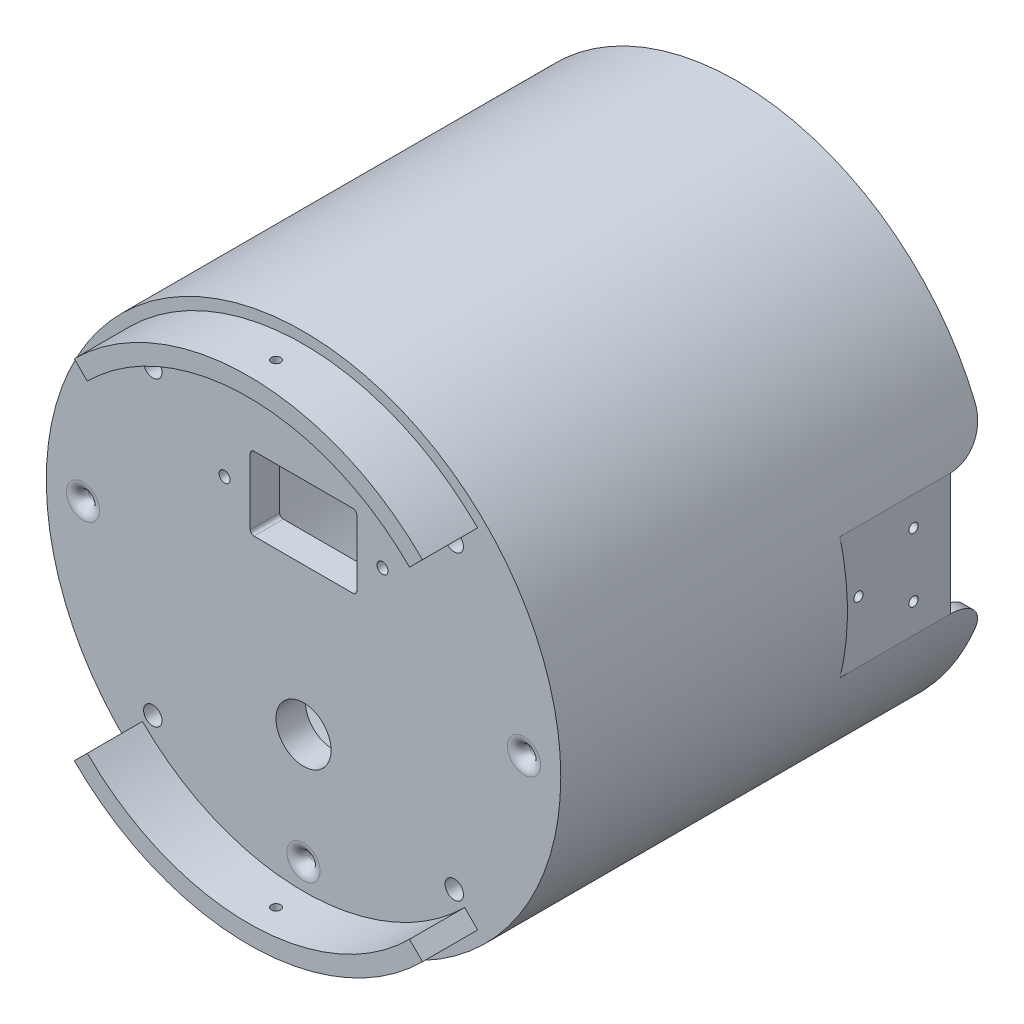
from build123d import *
from build123d.topology import SkipClean

# Parameters (mm, degrees)
SKETCH1_R               = 70
SKETCH1_R_2             = 67
BOSS_EXTRUDE1_DEPTH     = 8
SKETCH2_R               = 1.5
CUT_EXTRUDE2_DEPTH      = 20
BOSS_EXTRUDE2_START     = -100
SKETCH1_3_R             = 70
SKETCH1_3_R_2           = 67
BOSS_EXTRUDE2_DEPTH     = 100
BOSS_EXTRUDE3_DEPTH     = 15
CUT_EXTRUDE3_DEPTH      = 117
CUT_EXTRUDE3_DEPTH_BACK = 117
SKETCH5_R               = 1.25
FILLET4_R               = 3
SKETCH7_R               = 2.5
CUT_EXTRUDE6_DEPTH      = 14
CUT_EXTRUDE7_DEPTH      = 2
SKETCH9_R               = 1.5
SKETCH9_R_2             = 7.5
SKETCH9_W               = 29
SKETCH9_H               = 20
CUT_EXTRUDE8_DEPTH      = 28
BOSS_EXTRUDE4_DEPTH     = 30
CUT_EXTRUDE9_DEPTH      = 40
FILLET5_R               = 1
CUT_EXTRUDE10_DEPTH     = 30
BOSS_EXTRUDE5_START     = 10
BOSS_EXTRUDE5_DEPTH     = 10
FILLET6_START           = -69
FILLET6_DEPTH           = 138


with BuildPart() as part:
    # Sketch1 → Boss-Extrude1 (new body)
    # profile 1 of 2: a face of its own
    with BuildSketch(Plane.XY):
        Circle(SKETCH1_R)
        Circle(SKETCH1_R_2, mode=Mode.SUBTRACT)
    # profile 2 of 2: a face of its own
    with BuildSketch(Plane.XY):
        Circle(SKETCH1_R_2)
    extrude(amount=BOSS_EXTRUDE1_DEPTH)

    # Sketch2 → Cut-Extrude2 (cut)
    with BuildSketch(Plane.XY.offset(8)):
        with Locations((-60, 0)):
            Circle(SKETCH2_R)
        with Locations((60, 0)):
            Circle(SKETCH2_R)
        with Locations((0, 55)):
            Circle(SKETCH2_R)
        with Locations((0, -55)):
            Circle(SKETCH2_R)
    extrude(amount=-CUT_EXTRUDE2_DEPTH, mode=Mode.SUBTRACT)

    # Sketch1<3> → Boss-Extrude2 (add)
    with BuildSketch(Plane.XY.offset(BOSS_EXTRUDE2_START)):
        Circle(SKETCH1_3_R)
        Circle(SKETCH1_3_R_2, mode=Mode.SUBTRACT)
    extrude(amount=BOSS_EXTRUDE2_DEPTH)

    # Sketch3 → Boss-Extrude3 (add)
    with BuildSketch(Plane.XY.offset(8)):
        with BuildLine():
            ThreePointArc((-43.840620434, -43.840620434), (0, -62), (43.840620434, -43.840620434))
            Line((43.840620434, -43.840620434), (47.376154339, -47.376154339))
            ThreePointArc((47.376154339, -47.376154339), (0, -67), (-47.376154339, -47.376154339))
            Line((-47.376154339, -47.376154339), (-43.840620434, -43.840620434))
        make_face()
        with BuildLine():
            ThreePointArc((43.840620434, 43.840620434), (0, 62), (-43.840620434, 43.840620434))
            Line((-43.840620434, 43.840620434), (-47.376154339, 47.376154339))
            ThreePointArc((-47.376154339, 47.376154339), (0, 67), (47.376154339, 47.376154339))
            Line((47.376154339, 47.376154339), (43.840620434, 43.840620434))
        make_face()
    extrude(amount=BOSS_EXTRUDE3_DEPTH)

    # Sketch5 → Cut-Extrude3 (cut, two sides: drawn at the far end of the back side and taken through both)
    with BuildSketch(Plane(origin=(0, 0, 0), x_dir=(1, 0, 0), z_dir=(0, 1, 0)).offset(-CUT_EXTRUDE3_DEPTH_BACK)):
        with Locations(Location((0, -15.5, 0), (0, 0, 90))):
            Circle(SKETCH5_R)
    extrude(amount=CUT_EXTRUDE3_DEPTH + CUT_EXTRUDE3_DEPTH_BACK, mode=Mode.SUBTRACT)

    # Fillet4
    fillet4_edges = [part.edges().sort_by_distance(p)[0] for p in [
        (-61.5, 0, 8),
        (-1.5, 55, 8),
        (58.5, 0, 8),
        (-1.5, -55, 8),
    ]]
    fillet(fillet4_edges, radius=FILLET4_R)

    # Sketch7 → Cut-Extrude6 (cut)
    with BuildSketch(Plane.XY.offset(8)):
        with Locations((41.012193309, 41.012193309)):
            Circle(SKETCH7_R)
        with Locations((41.012193309, -41.012193309)):
            Circle(SKETCH7_R)
        with Locations((-41.012193309, -41.012193309)):
            Circle(SKETCH7_R)
        with Locations((-41.012193309, 41.012193309)):
            Circle(SKETCH7_R)
    extrude(amount=-CUT_EXTRUDE6_DEPTH, mode=Mode.SUBTRACT)

    # Sketch8 → Cut-Extrude7 (cut)
    with BuildSketch(Plane(origin=(0, 0, 0), x_dir=(-1, 0, 0), z_dir=(0, 0, -1))):
        Polygon((39.841147095, 36.663785466), (44.192501859, 37.823833617), (45.363548073, 42.17224146), (42.183239523, 45.360601151), (37.831884758, 44.200553), (36.660838544, 39.852145158), align=None)
        Polygon((-36.663785466, 39.841147095), (-37.823833617, 44.192501859), (-42.17224146, 45.363548073), (-45.360601151, 42.183239523), (-44.200553, 37.831884758), (-39.852145158, 36.660838544), align=None)
        Polygon((36.663785466, -39.841147095), (37.823833617, -44.192501859), (42.17224146, -45.363548073), (45.360601151, -42.183239523), (44.200553, -37.831884758), (39.852145158, -36.660838544), align=None)
        Polygon((-39.841147095, -36.663785466), (-44.192501859, -37.823833617), (-45.363548073, -42.17224146), (-42.183239523, -45.360601151), (-37.831884758, -44.200553), (-36.660838544, -39.852145158), align=None)
    extrude(amount=-CUT_EXTRUDE7_DEPTH, mode=Mode.SUBTRACT)

    # Sketch9 → Cut-Extrude8 (cut)
    with BuildSketch(Plane.XY.offset(8)):
        with Locations((-21.5, 25)):
            Circle(SKETCH9_R)
        with Locations((21.5, 25)):
            Circle(SKETCH9_R)
        with Locations((0, -25)):
            Circle(SKETCH9_R_2)
        with Locations((0, 25)):
            Rectangle(SKETCH9_W, SKETCH9_H)
    extrude(amount=-CUT_EXTRUDE8_DEPTH, mode=Mode.SUBTRACT)

    # Sketch11 → Boss-Extrude4 (add)
    with SkipClean():  # the faces are left unmerged after this step: merging them gives an invalid solid
        with BuildSketch(Plane(origin=(0, 0, -100), x_dir=(-1, 0, 0), z_dir=(0, 0, -1))):
            with BuildLine():
                ThreePointArc((67, 0), (66.623944645, 7.088723439), (65.5, 14.09787218))
                Line((65.5, 14.09787218), (65.5, 0))
                Line((65.5, 0), (67, 0))
            make_face()
            with BuildLine():
                Line((67, 0), (65.5, 0))
                Line((65.5, 0), (65.5, -14.09787218))
                ThreePointArc((65.5, -14.09787218), (66.623944645, -7.088723439), (67, 0))
            make_face()
            with BuildLine():
                ThreePointArc((70, 0), (68.865811547, 12.549900398), (65.5, 24.69311645))
                Line((65.5, 24.69311645), (65.5, 14.09787218))
                ThreePointArc((65.5, 14.09787218), (66.623944645, 7.088723439), (67, 0))
                Line((67, 0), (70, 0))
            make_face()
            with BuildLine():
                ThreePointArc((65.5, -24.69311645), (68.865811547, -12.549900398), (70, 0))
                Line((70, 0), (67, 0))
                ThreePointArc((67, 0), (66.623944645, -7.088723439), (65.5, -14.09787218))
                Line((65.5, -14.09787218), (65.5, -24.69311645))
            make_face()
        boss_extrude4 = extrude(amount=-BOSS_EXTRUDE4_DEPTH)

    # Sketch13 → Cut-Extrude9 (cut)
    with SkipClean():  # the faces are left unmerged after this step: merging them gives an invalid solid
        with BuildSketch(Plane(origin=(-65.5, 0, 0), x_dir=(0, 0, -1), z_dir=(1, 0, 0))):
            with BuildLine():
                ThreePointArc((91.041352866, 7.968817701), (91.196701943, 8.299138463), (91.25, 8.660254038))
                ThreePointArc((91.25, 8.660254038), (90.28561571, 9.877186109), (88.880522134, 9.216373906))
                ThreePointArc((88.880522134, 9.216373906), (90, 8.660254038), (91.041352866, 7.968817701))
            make_face()
            with BuildLine():
                ThreePointArc((91.041352866, 7.968817701), (90, 8.660254038), (88.880522134, 9.216373906))
                ThreePointArc((88.880522134, 9.216373906), (89.375, 7.577722283), (91.041352866, 7.968817701))
            make_face()
            with BuildLine():
                ThreePointArc((76.25, 0), (75.911086234, 0.855816496), (75.078125, 1.247556205))
                ThreePointArc((75.078125, 1.247556205), (75, 0), (75.078125, -1.247556205))
                ThreePointArc((75.078125, -1.247556205), (75.911086234, -0.855816496), (76.25, 0))
            make_face()
            with BuildLine():
                ThreePointArc((75.078125, -1.247556205), (75, 0), (75.078125, 1.247556205))
                ThreePointArc((75.078125, 1.247556205), (73.75, 0), (75.078125, -1.247556205))
            make_face()
            with BuildLine():
                ThreePointArc((88.880522134, -9.216373906), (90.28561571, -9.877186109), (91.25, -8.660254038))
                ThreePointArc((91.25, -8.660254038), (91.196701943, -8.299138463), (91.041352866, -7.968817701))
                ThreePointArc((91.041352866, -7.968817701), (90, -8.660254038), (88.880522134, -9.216373906))
            make_face()
            with BuildLine():
                ThreePointArc((88.880522134, -9.216373906), (90, -8.660254038), (91.041352866, -7.968817701))
                ThreePointArc((91.041352866, -7.968817701), (89.375, -7.577722283), (88.880522134, -9.216373906))
            make_face()
        cut_extrude9 = extrude(amount=-CUT_EXTRUDE9_DEPTH, mode=Mode.SUBTRACT)

    # Mirror2: Boss-Extrude4, Cut-Extrude9 across plane
    with SkipClean():  # the faces are left unmerged after this step: merging them gives an invalid solid
        add(boss_extrude4.mirror(Plane(origin=(0, 0, 0), x_dir=(0, 0, 1), z_dir=(1, 0, 0))))
        add(cut_extrude9.mirror(Plane(origin=(0, 0, 0), x_dir=(0, 0, 1), z_dir=(1, 0, 0))), mode=Mode.SUBTRACT)

    # Fillet5
    fillet5_edges = [part.edges().sort_by_distance(p)[0] for p in [
        (-14.5, 35, 4),
        (14.5, 35, 4),
        (14.5, 15, 4),
        (-14.5, 15, 4),
    ]]
    fillet(fillet5_edges, radius=FILLET5_R)

    # Sketch14 → Cut-Extrude10 (cut)
    with SkipClean():  # the faces are left unmerged after this step: merging them gives an invalid solid
        with BuildSketch(Plane(origin=(0, 0, -100), x_dir=(-1, 0, 0), z_dir=(0, 0, -1))):
            with BuildLine():
                ThreePointArc((70, 0), (69.498201416, 8.366600265), (68, 16.613247726))
                Line((68, 16.613247726), (68, 0))
                Line((68, 0), (70, 0))
            make_face()
            with BuildLine():
                Line((70, 0), (68, 0))
                Line((68, 0), (68, -16.613247726))
                ThreePointArc((68, -16.613247726), (69.498201416, -8.366600265), (70, 0))
            make_face()
        cut_extrude10 = extrude(amount=-CUT_EXTRUDE10_DEPTH, mode=Mode.SUBTRACT)

    # Mirror4: Cut-Extrude10 across plane
    with SkipClean():  # the faces are left unmerged after this step: merging them gives an invalid solid
        add(cut_extrude10.mirror(Plane(origin=(0, 0, 0), x_dir=(0, 0, 1), z_dir=(1, 0, 0))), mode=Mode.SUBTRACT)

    # Sketch15 → Boss-Extrude5 (add)
    with SkipClean():  # the faces are left unmerged after this step: merging them gives an invalid solid
        with BuildSketch(Plane(origin=(0, 0, -100), x_dir=(-1, 0, 0), z_dir=(0, 0, -1)).offset(BOSS_EXTRUDE5_START)):
            with BuildLine():
                Line((-68, -16.613247726), (-64.907626671, -16.613247726))
                ThreePointArc((-64.907626671, -16.613247726), (0, -67), (64.907626671, -16.613247726))
                Line((64.907626671, -16.613247726), (68, -16.613247726))
                ThreePointArc((68, -16.613247726), (0, -70), (-68, -16.613247726))
            make_face()
            with BuildLine():
                Line((-68, 16.613247726), (-64.907626671, 16.613247726))
                ThreePointArc((-64.907626671, 16.613247726), (0, 67), (64.907626671, 16.613247726))
                Line((64.907626671, 16.613247726), (68, 16.613247726))
                ThreePointArc((68, 16.613247726), (0, 70), (-68, 16.613247726))
            make_face()
        extrude(amount=-BOSS_EXTRUDE5_DEPTH)

    # Fillet6: read off the stored shape, not the designer's step
    # Fillet6 outline → Fillet6 (cut)
    with SkipClean():  # the faces are left unmerged after this step: merging them gives an invalid solid
        with BuildSketch(Plane.YZ.offset(FILLET6_START)):
            with BuildLine():
                Line((-16.613247726, -110), (-16.613247726, -100))
                ThreePointArc((-16.613247726, -100), (-19.542179914, -107.071067812), (-26.613247726, -110))
                Line((-26.613247726, -110), (-16.613247726, -110))
            make_face()
            with BuildLine():
                ThreePointArc((26.613247726, -110), (19.542179914, -107.071067812), (16.613247726, -100))
                Line((16.613247726, -100), (16.613247726, -110))
                Line((16.613247726, -110), (26.613247726, -110))
            make_face()
        extrude(amount=FILLET6_DEPTH, mode=Mode.SUBTRACT)


solid = part.part
